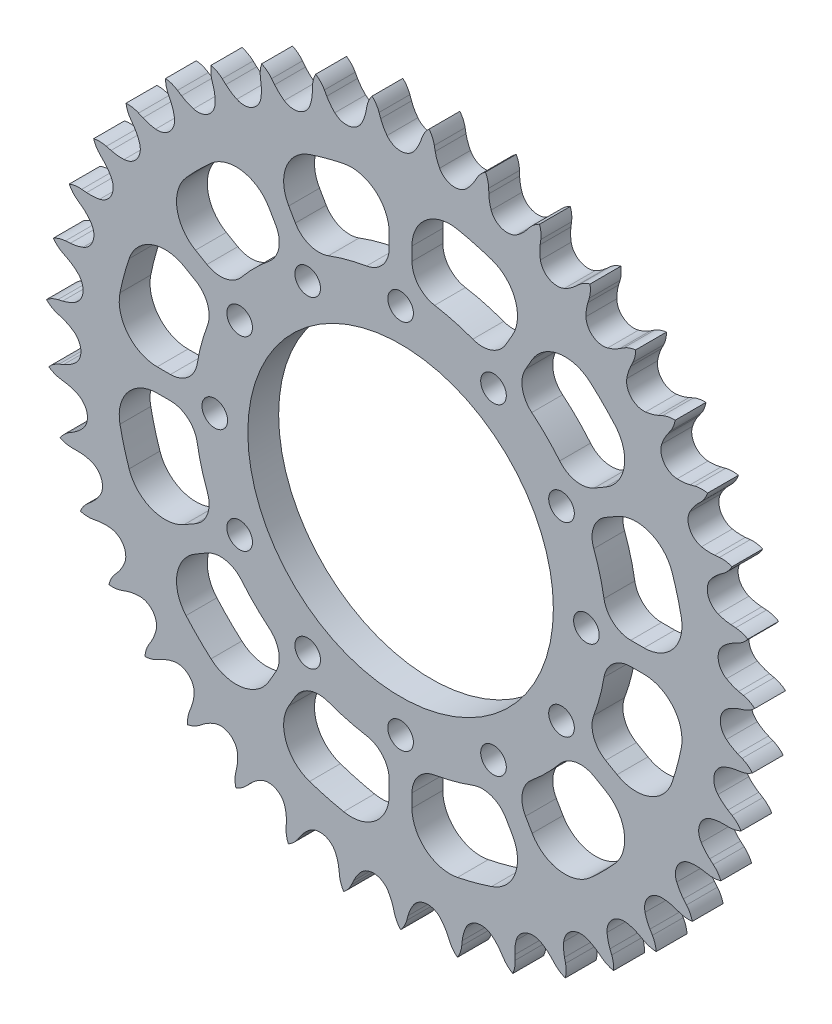
from build123d import *

# Parameters (mm, degrees)
EXTRUSION_DEPTH        = 7.2136
CUT_EXTRUDE_DEPTH      = 118.514389318
CUT_EXTRUDE_DEPTH_BACK = 118.514389318
SKETCH1_R              = 35.764294032
F_6_0MM_DOWEL_HOLE1_D  = 6
CIRPATTERN1_COUNT      = 12
CUT_OUT1_DEPTH         = 118.514389318
FILLET2_R              = 6.35
FILLET3_R              = 8.89


with BuildPart() as part:
    # Teeth Sketch → Extrusion (new body)
    with BuildSketch(Plane.XY):
        with BuildLine():
            ThreePointArc((6.676484762, 82.703103732), (5.710873677, 81.555589606), (5.037571935, 80.215493266))
            Line((5.037571935, 80.215493266), (4.65053543, 79.150636707))
            ThreePointArc((4.65053543, 79.150636707), (4.012412733, 77.75443626), (3.175286755, 76.467658749))
            ThreePointArc((3.175286755, 76.467658749), (0, 74.905926143), (-3.175286755, 76.467658749))
            ThreePointArc((-3.175286755, 76.467658749), (-4.012412733, 77.75443626), (-4.65053543, 79.150636707))
            Line((-4.65053543, 79.150636707), (-5.037571935, 80.215493266))
            ThreePointArc((-5.037571935, 80.215493266), (-5.710873677, 81.555589606), (-6.676484762, 82.703103732))
            ThreePointArc((-6.676484762, 82.703103732), (-7.445517227, 81.415554702), (-7.895133318, 79.984807062))
            Line((-7.895133318, 79.984807062), (-8.106342797, 78.871655094))
            ThreePointArc((-8.106342797, 78.871655094), (-8.512235671, 77.391172997), (-9.132107458, 75.986774467))
            ThreePointArc((-9.132107458, 75.986774467), (-12.015755556, 73.935914073), (-15.40044271, 74.968070836))
            ThreePointArc((-15.40044271, 74.968070836), (-16.433141755, 76.103900466), (-17.286967233, 77.379658404))
            Line((-17.286967233, 77.379658404), (-17.83980672, 78.368640329))
            ThreePointArc((-17.83980672, 78.368640329), (-18.719355953, 79.583377579), (-19.856536839, 80.561136787))
            ThreePointArc((-19.856536839, 80.561136787), (-20.409073146, 79.166899696), (-20.623358765, 77.682556369))
            Line((-20.623358765, 77.682556369), (-20.653271004, 76.549939044))
            ThreePointArc((-20.653271004, 76.549939044), (-20.816421642, 75.023519006), (-21.202984886, 73.53787264))
            ThreePointArc((-21.202984886, 73.53787264), (-23.720309356, 71.051000665), (-27.226735288, 71.526849267))
            ThreePointArc((-27.226735288, 71.526849267), (-28.428261037, 72.482313625), (-29.475675664, 73.604587595))
            Line((-29.475675664, 73.604587595), (-30.179999883, 74.492080773))
            ThreePointArc((-30.179999883, 74.492080773), (-31.243016742, 75.549997876), (-32.522315041, 76.332678717))
            ThreePointArc((-32.522315041, 76.332678717), (-32.844044791, 74.867863573), (-32.817450053, 73.368368272))
            Line((-32.817450053, 73.368368272), (-32.66529034, 72.245619783))
            ThreePointArc((-32.66529034, 72.245619783), (-32.581473228, 70.71279528), (-32.724716142, 69.18437854))
            ThreePointArc((-32.724716142, 69.18437854), (-34.810519602, 66.325903661), (-38.347869723, 66.233119874))
            ThreePointArc((-38.347869723, 66.233119874), (-39.687103291, 66.983472935), (-40.900979579, 67.923196629))
            Line((-40.900979579, 67.923196629), (-41.738546902, 68.686215454))
            ThreePointArc((-41.738546902, 68.686215454), (-42.957499809, 69.559912912), (-44.345782367, 70.127244363))
            ThreePointArc((-44.345782367, 70.127244363), (-44.428372928, 68.629789109), (-44.161586623, 67.153977974))
            Line((-44.161586623, 67.153977974), (-43.831295815, 66.070176918))
            ThreePointArc((-43.831295815, 66.070176918), (-43.50268177, 64.570647301), (-43.39889444, 63.039045376))
            ThreePointArc((-43.39889444, 63.039045376), (-44.999155676, 59.883000591), (-48.475814476, 59.223987466))
            ThreePointArc((-48.475814476, 59.223987466), (-49.918070416, 59.74979548), (-51.266969607, 60.48263055))
            Line((-51.266969607, 60.48263055), (-52.21608748, 61.101413234))
            ThreePointArc((-52.21608748, 61.101413234), (-53.559406195, 61.768262742), (-55.020717224, 62.105551216))
            ThreePointArc((-55.020717224, 62.105551216), (-54.862029543, 60.614239157), (-54.361961296, 59.200334922))
            Line((-54.361961296, 59.200334922), (-53.862093752, 58.183551176))
            ThreePointArc((-53.862093752, 58.183551176), (-53.297193706, 56.756153473), (-52.949064168, 55.26103405))
            ThreePointArc((-52.949064168, 55.26103405), (-54.022337255, 51.889159262), (-57.348261097, 50.680984892))
            ThreePointArc((-57.348261097, 50.680984892), (-58.856185739, 50.968629708), (-60.305172051, 51.475596109))
            Line((-60.305172051, 51.475596109), (-61.34125882, 51.934116506))
            ThreePointArc((-61.34125882, 51.934116506), (-62.774152094, 52.376847013), (-64.270644405, 52.475356916))
            ThreePointArc((-64.270644405, 52.475356916), (-63.87478841, 51.02881225), (-63.154389727, 49.713434291))
            Line((-63.154389727, 49.713434291), (-62.497891753, 48.790002021))
            ThreePointArc((-62.497891753, 48.790002021), (-61.711336321, 47.471705084), (-61.127880947, 46.05179097))
            ThreePointArc((-61.127880947, 46.05179097), (-61.646368676, 42.551415963), (-64.73541788, 40.825371431))
            ThreePointArc((-64.73541788, 40.825371431), (-66.269956766, 40.867403199), (-67.781502216, 41.135370767))
            Line((-67.781502216, 41.135370767), (-68.877723777, 41.42175344))
            ThreePointArc((-68.877723777, 41.42175344), (-70.363080428, 41.628898458), (-71.855995657, 41.486078435))
            ThreePointArc((-71.855995657, 41.486078435), (-71.23322381, 40.12176591), (-70.311152637, 38.938981826))
            Line((-70.311152637, 38.938981826), (-69.515027187, 38.132817442))
            ThreePointArc((-69.515027187, 38.132817442), (-68.52718774, 36.957764468), (-67.723517718, 35.649830693))
            ThreePointArc((-67.723517718, 35.649830693), (-67.673791529, 32.111613343), (-70.445961343, 29.912402295))
            ThreePointArc((-70.445961343, 29.912402295), (-71.967370724, 29.707732413), (-73.502327078, 29.729760931))
            Line((-73.502327078, 29.729760931), (-74.630291869, 29.836588719))
            ThreePointArc((-74.630291869, 29.836588719), (-76.129641939, 29.8027833), (-77.580314364, 29.422332315))
            ThreePointArc((-77.580314364, 29.422332315), (-76.74675613, 28.175586908), (-75.646893627, 27.156030185))
            Line((-75.646893627, 27.156030185), (-74.731759931, 26.488012922))
            ThreePointArc((-74.731759931, 26.488012922), (-73.568220993, 25.486637166), (-72.565150954, 24.324558527))
            ThreePointArc((-72.565150954, 24.324558527), (-71.948498729, 20.840136804), (-74.331991411, 18.224717651))
            ThreePointArc((-74.331991411, 18.224717651), (-75.800867582, 17.778646963), (-77.319480277, 17.554165902))
            Line((-77.319480277, 17.554165902), (-78.449974603, 17.478672021))
            ThreePointArc((-78.449974603, 17.478672021), (-79.924485713, 17.204791709), (-81.295343681, 16.596563242))
            ThreePointArc((-81.295343681, 16.596563242), (-80.27258778, 15.499675005), (-79.023419807, 14.669751627))
            Line((-79.023419807, 14.669751627), (-78.012979347, 14.15718278))
            ThreePointArc((-78.012979347, 14.15718278), (-76.703875965, 13.355419348), (-75.527384897, 12.369293072))
            ThreePointArc((-75.527384897, 12.369293072), (-74.359777605, 9.028911669), (-76.292861946, 6.065022393))
            ThreePointArc((-76.292861946, 6.065022393), (-77.671161786, 5.389103895), (-79.134099551, 4.923927198))
            Line((-79.134099551, 4.923927198), (-80.237844202, 4.6680669))
            ThreePointArc((-80.237844202, 4.6680669), (-81.649327289, 4.161205049), (-82.904866299, 3.340951899))
            ThreePointArc((-82.904866299, 3.340951899), (-81.719401571, 2.422329661), (-80.353280924, 1.803534207))
            Line((-80.353280924, 1.803534207), (-79.273703577, 1.45968904))
            ThreePointArc((-79.273703577, 1.45968904), (-77.852940841, 0.878303185), (-76.533499244, 0.093669424))
            ThreePointArc((-76.533499244, 0.093669424), (-74.8451773, -3.016157536), (-76.277787432, -6.251753759))
            ThreePointArc((-76.277787432, -6.251753759), (-77.529813699, -7.140014132), (-78.899187214, -7.833838635))
            Line((-78.899187214, -7.833838635), (-79.947595784, -8.263438702))
            ThreePointArc((-79.947595784, -8.263438702), (-81.259494176, -8.990154635), (-82.367196428, -10.001188343))
            ThreePointArc((-82.367196428, -10.001188343), (-81.049725787, -10.717752749), (-79.602034272, -11.109393802))
            Line((-79.602034272, -11.109393802), (-78.481280524, -11.275609878))
            ThreePointArc((-78.481280524, -11.275609878), (-76.985655443, -11.621560569), (-75.557436162, -12.184380212))
            ThreePointArc((-75.557436162, -12.184380212), (-73.392126218, -14.983109845), (-74.28715829, -18.406612773))
            ThreePointArc((-74.28715829, -18.406612773), (-75.380484162, -19.484209545), (-76.620827372, -20.388712162))
            Line((-76.620827372, -20.388712162), (-77.586746629, -20.980925582))
            ThreePointArc((-77.586746629, -20.980925582), (-78.765082849, -21.908674036), (-79.696259435, -23.08430306))
            ThreePointArc((-79.696259435, -23.08430306), (-78.280904679, -23.580250992), (-76.789136745, -23.734594346))
            Line((-76.789136745, -23.734594346), (-75.656233531, -23.718876424))
            ThreePointArc((-75.656233531, -23.718876424), (-74.124482008, -23.820432009), (-72.624475172, -24.146860802))
            ThreePointArc((-72.624475172, -24.146860802), (-70.038257617, -26.562007479), (-70.372530769, -30.084750184))
            ThreePointArc((-70.372530769, -30.084750184), (-71.27883968, -31.323774165), (-72.358028349, -32.415528753))
            Line((-72.358028349, -32.415528753), (-73.216441492, -33.155017511))
            ThreePointArc((-73.216441492, -33.155017511), (-74.230697248, -34.259770288), (-74.961231185, -35.569546454))
            ThreePointArc((-74.961231185, -35.569546454), (-73.484649258, -35.832033121), (-71.987440912, -35.745081364))
            Line((-71.987440912, -35.745081364), (-70.871729829, -35.547836529))
            ThreePointArc((-70.871729829, -35.547836529), (-69.343523424, -35.402366773), (-67.810578422, -35.48395038))
            ThreePointArc((-67.810578422, -35.48395038), (-64.870434934, -37.452963072), (-64.635291667, -40.983708369))
            ThreePointArc((-64.635291667, -40.983708369), (-65.331110692, -42.352069487), (-66.221194398, -43.602800177))
            Line((-66.221194398, -43.602800177), (-66.949868978, -44.470411902))
            ThreePointArc((-66.949868978, -44.470411902), (-67.773775581, -45.723556485), (-68.284746423, -47.133557278))
            ThreePointArc((-68.284746423, -47.133557278), (-66.785180021, -47.155784414), (-65.321308173, -46.829789551))
            Line((-65.321308173, -46.829789551), (-64.251685552, -46.456126341))
            ThreePointArc((-64.251685552, -46.456126341), (-62.766604009, -46.067398833), (-61.240423311, -45.902024283))
            ThreePointArc((-61.240423311, -45.902024283), (-58.022502061, -47.373906594), (-57.224032462, -50.821210034))
            ThreePointArc((-57.224032462, -50.821210034), (-57.691340253, -52.283468456), (-58.369266298, -53.66078198))
            Line((-58.369266298, -53.66078198), (-58.949330025, -54.634045983))
            ThreePointArc((-58.949330025, -54.634045983), (-59.561548726, -56.003126587), (-59.839722596, -57.476833727))
            ThreePointArc((-59.839722596, -57.476833727), (-58.356009703, -57.25822566), (-56.963387864, -56.701630787))
            Line((-56.963387864, -56.701630787), (-55.967556369, -56.161226883))
            ThreePointArc((-55.967556369, -56.161226883), (-54.564062519, -55.539309461), (-53.084173404, -55.131259867))
            ThreePointArc((-53.084173404, -55.131259867), (-49.671816862, -56.06789082), (-48.330700874, -59.342469055))
            ThreePointArc((-48.330700874, -59.342469055), (-48.557394406, -60.860753056), (-49.00560486, -62.328977716))
            Line((-49.00560486, -62.328977716), (-49.422034389, -63.382686971))
            ThreePointArc((-49.422034389, -63.382686971), (-49.806709045, -64.832245127), (-49.844881387, -66.331490374))
            ThreePointArc((-49.844881387, -66.331490374), (-48.415449386, -65.877708938), (-47.130145731, -65.104929569))
            Line((-47.130145731, -65.104929569), (-46.233896874, -64.411781148))
            ThreePointArc((-46.233896874, -64.411781148), (-44.948340472, -63.572781148), (-43.55307129, -62.932624781))
            ThreePointArc((-43.55307129, -62.932624781), (-40.034657698, -63.309746125), (-38.185629521, -66.326789298))
            ThreePointArc((-38.185629521, -66.326789298), (-38.16583755, -67.86177612), (-38.372723998, -69.38288567))
            Line((-38.372723998, -69.38288567), (-38.614734022, -70.489749661))
            ThreePointArc((-38.614734022, -70.489749661), (-38.761901763, -71.982242573), (-38.559083932, -73.468196262))
            ThreePointArc((-38.559083932, -73.468196262), (-37.220954361, -72.790994159), (-36.076257579, -71.822044874))
            Line((-36.076257579, -71.822044874), (-35.302803736, -70.994104116))
            ThreePointArc((-35.302803736, -70.994104116), (-34.168480016, -69.959751196), (-32.893967506, -69.104067769))
            ThreePointArc((-32.893967506, -69.104067769), (-29.360621929, -68.91191226), (-27.051570421, -71.593280539))
            ThreePointArc((-27.051570421, -71.593280539), (-26.785805549, -73.105214829), (-26.74600974, -74.639813329))
            Line((-26.74600974, -74.639813329), (-26.807332328, -75.77116486))
            ThreePointArc((-26.807332328, -75.77116486), (-26.713181585, -77.267937748), (-26.274626458, -78.702114459))
            ThreePointArc((-26.274626458, -78.702114459), (-25.06245617, -77.819030866), (-24.088013307, -76.679006943))
            Line((-24.088013307, -76.679006943), (-23.457386525, -75.737717079))
            ThreePointArc((-23.457386525, -75.737717079), (-22.503673876, -74.534800437), (-21.382927243, -73.485751701))
            ThreePointArc((-21.382927243, -73.485751701), (-17.926161474, -72.729296065), (-15.216889857, -75.005543419))
            ThreePointArc((-15.216889857, -75.005543419), (-14.712035254, -76.455266874), (-14.426587879, -77.96360903))
            Line((-14.426587879, -77.96360903), (-14.305634807, -79.090146691))
            ThreePointArc((-14.305634807, -79.090146691), (-13.972604036, -80.552433921), (-13.309669959, -81.897689231))
            ThreePointArc((-13.309669959, -81.897689231), (-12.254853529, -80.83159555), (-11.475902142, -79.55002301))
            Line((-11.475902142, -79.55002301), (-11.004435324, -78.519762952))
            ThreePointArc((-11.004435324, -78.519762952), (-10.256034403, -77.179437497), (-9.318080396, -75.964193264))
            ThreePointArc((-9.318080396, -75.964193264), (-6.027422853, -74.663029306), (-2.988099839, -76.475202124))
            ThreePointArc((-2.988099839, -76.475202124), (-2.257230974, -77.825167667), (-1.733524971, -79.26818821))
            Line((-1.733524971, -79.26818821), (-1.43342886, -80.360735266))
            ThreePointArc((-1.43342886, -80.360735266), (-0.870143382, -81.750664368), (0, -82.97215687))
            ThreePointArc((0, -82.97215687), (0.870143382, -81.750664368), (1.43342886, -80.360735266))
            Line((1.43342886, -80.360735266), (1.733524971, -79.26818821))
            ThreePointArc((1.733524971, -79.26818821), (2.257230974, -77.825167667), (2.988099839, -76.475202124))
            ThreePointArc((2.988099839, -76.475202124), (6.027422853, -74.663029306), (9.318080396, -75.964193264))
            ThreePointArc((9.318080396, -75.964193264), (10.256034403, -77.179437497), (11.004435324, -78.519762952))
            Line((11.004435324, -78.519762952), (11.475902142, -79.55002301))
            ThreePointArc((11.475902142, -79.55002301), (12.254853529, -80.83159555), (13.309669959, -81.897689231))
            ThreePointArc((13.309669959, -81.897689231), (13.972604036, -80.552433921), (14.305634807, -79.090146691))
            Line((14.305634807, -79.090146691), (14.426587879, -77.96360903))
            ThreePointArc((14.426587879, -77.96360903), (14.712035254, -76.455266874), (15.216889857, -75.005543419))
            ThreePointArc((15.216889857, -75.005543419), (17.926161474, -72.729296065), (21.382927243, -73.485751701))
            ThreePointArc((21.382927243, -73.485751701), (22.503673876, -74.534800437), (23.457386525, -75.737717079))
            Line((23.457386525, -75.737717079), (24.088013307, -76.679006943))
            ThreePointArc((24.088013307, -76.679006943), (25.06245617, -77.819030866), (26.274626458, -78.702114459))
            ThreePointArc((26.274626458, -78.702114459), (26.713181585, -77.267937748), (26.807332328, -75.77116486))
            Line((26.807332328, -75.77116486), (26.74600974, -74.639813329))
            ThreePointArc((26.74600974, -74.639813329), (26.785805549, -73.105214829), (27.051570421, -71.593280539))
            ThreePointArc((27.051570421, -71.593280539), (29.360621929, -68.91191226), (32.893967506, -69.104067769))
            ThreePointArc((32.893967506, -69.104067769), (34.168480016, -69.959751196), (35.302803736, -70.994104116))
            Line((35.302803736, -70.994104116), (36.076257579, -71.822044874))
            ThreePointArc((36.076257579, -71.822044874), (37.220954361, -72.790994159), (38.559083932, -73.468196262))
            ThreePointArc((38.559083932, -73.468196262), (38.761901763, -71.982242573), (38.614734022, -70.489749661))
            Line((38.614734022, -70.489749661), (38.372723998, -69.38288567))
            ThreePointArc((38.372723998, -69.38288567), (38.16583755, -67.86177612), (38.185629521, -66.326789298))
            ThreePointArc((38.185629521, -66.326789298), (40.034657698, -63.309746125), (43.55307129, -62.932624781))
            ThreePointArc((43.55307129, -62.932624781), (44.948340472, -63.572781148), (46.233896874, -64.411781148))
            Line((46.233896874, -64.411781148), (47.130145731, -65.104929569))
            ThreePointArc((47.130145731, -65.104929569), (48.415449386, -65.877708938), (49.844881387, -66.331490374))
            ThreePointArc((49.844881387, -66.331490374), (49.806709045, -64.832245127), (49.422034389, -63.382686971))
            Line((49.422034389, -63.382686971), (49.00560486, -62.328977716))
            ThreePointArc((49.00560486, -62.328977716), (48.557394406, -60.860753056), (48.330700874, -59.342469055))
            ThreePointArc((48.330700874, -59.342469055), (49.671816862, -56.06789082), (53.084173404, -55.131259867))
            ThreePointArc((53.084173404, -55.131259867), (54.564062519, -55.539309461), (55.967556369, -56.161226883))
            Line((55.967556369, -56.161226883), (56.963387864, -56.701630787))
            ThreePointArc((56.963387864, -56.701630787), (58.356009703, -57.25822566), (59.839722596, -57.476833727))
            ThreePointArc((59.839722596, -57.476833727), (59.561548726, -56.003126587), (58.949330025, -54.634045983))
            Line((58.949330025, -54.634045983), (58.369266298, -53.66078198))
            ThreePointArc((58.369266298, -53.66078198), (57.691340253, -52.283468456), (57.224032462, -50.821210034))
            ThreePointArc((57.224032462, -50.821210034), (58.022502061, -47.373906594), (61.240423311, -45.902024283))
            ThreePointArc((61.240423311, -45.902024283), (62.766604009, -46.067398833), (64.251685552, -46.456126341))
            Line((64.251685552, -46.456126341), (65.321308173, -46.829789551))
            ThreePointArc((65.321308173, -46.829789551), (66.785180021, -47.155784414), (68.284746423, -47.133557278))
            ThreePointArc((68.284746423, -47.133557278), (67.773775581, -45.723556485), (66.949868978, -44.470411902))
            Line((66.949868978, -44.470411902), (66.221194398, -43.602800177))
            ThreePointArc((66.221194398, -43.602800177), (65.331110692, -42.352069487), (64.635291667, -40.983708369))
            ThreePointArc((64.635291667, -40.983708369), (64.870434934, -37.452963072), (67.810578422, -35.48395038))
            ThreePointArc((67.810578422, -35.48395038), (69.343523424, -35.402366773), (70.871729829, -35.547836529))
            Line((70.871729829, -35.547836529), (71.987440912, -35.745081364))
            ThreePointArc((71.987440912, -35.745081364), (73.484649258, -35.832033121), (74.961231185, -35.569546454))
            ThreePointArc((74.961231185, -35.569546454), (74.230697248, -34.259770288), (73.216441492, -33.155017511))
            Line((73.216441492, -33.155017511), (72.358028349, -32.415528753))
            ThreePointArc((72.358028349, -32.415528753), (71.27883968, -31.323774165), (70.372530769, -30.084750184))
            ThreePointArc((70.372530769, -30.084750184), (70.038257617, -26.562007479), (72.624475172, -24.146860802))
            ThreePointArc((72.624475172, -24.146860802), (74.124482008, -23.820432009), (75.656233531, -23.718876424))
            Line((75.656233531, -23.718876424), (76.789136745, -23.734594346))
            ThreePointArc((76.789136745, -23.734594346), (78.280904679, -23.580250992), (79.696259435, -23.08430306))
            ThreePointArc((79.696259435, -23.08430306), (78.765082849, -21.908674036), (77.586746629, -20.980925582))
            Line((77.586746629, -20.980925582), (76.620827372, -20.388712162))
            ThreePointArc((76.620827372, -20.388712162), (75.380484162, -19.484209545), (74.28715829, -18.406612773))
            ThreePointArc((74.28715829, -18.406612773), (73.392126218, -14.983109845), (75.557436162, -12.184380212))
            ThreePointArc((75.557436162, -12.184380212), (76.985655443, -11.621560569), (78.481280524, -11.275609878))
            Line((78.481280524, -11.275609878), (79.602034272, -11.109393802))
            ThreePointArc((79.602034272, -11.109393802), (81.049725787, -10.717752749), (82.367196428, -10.001188343))
            ThreePointArc((82.367196428, -10.001188343), (81.259494176, -8.990154635), (79.947595784, -8.263438702))
            Line((79.947595784, -8.263438702), (78.899187214, -7.833838635))
            ThreePointArc((78.899187214, -7.833838635), (77.529813699, -7.140014132), (76.277787432, -6.251753759))
            ThreePointArc((76.277787432, -6.251753759), (74.8451773, -3.016157536), (76.533499244, 0.093669424))
            ThreePointArc((76.533499244, 0.093669424), (77.852940841, 0.878303185), (79.273703577, 1.45968904))
            Line((79.273703577, 1.45968904), (80.353280924, 1.803534207))
            ThreePointArc((80.353280924, 1.803534207), (81.719401571, 2.422329661), (82.904866299, 3.340951899))
            ThreePointArc((82.904866299, 3.340951899), (81.649327289, 4.161205049), (80.237844202, 4.6680669))
            Line((80.237844202, 4.6680669), (79.134099551, 4.923927198))
            ThreePointArc((79.134099551, 4.923927198), (77.671161786, 5.389103895), (76.292861946, 6.065022393))
            ThreePointArc((76.292861946, 6.065022393), (74.359777605, 9.028911669), (75.527384897, 12.369293072))
            ThreePointArc((75.527384897, 12.369293072), (76.703875965, 13.355419348), (78.012979347, 14.15718278))
            Line((78.012979347, 14.15718278), (79.023419807, 14.669751627))
            ThreePointArc((79.023419807, 14.669751627), (80.27258778, 15.499675005), (81.295343681, 16.596563242))
            ThreePointArc((81.295343681, 16.596563242), (79.924485713, 17.204791709), (78.449974603, 17.478672021))
            Line((78.449974603, 17.478672021), (77.319480277, 17.554165902))
            ThreePointArc((77.319480277, 17.554165902), (75.800867582, 17.778646963), (74.331991411, 18.224717651))
            ThreePointArc((74.331991411, 18.224717651), (71.948498729, 20.840136804), (72.565150954, 24.324558527))
            ThreePointArc((72.565150954, 24.324558527), (73.568220993, 25.486637166), (74.731759931, 26.488012922))
            Line((74.731759931, 26.488012922), (75.646893627, 27.156030185))
            ThreePointArc((75.646893627, 27.156030185), (76.74675613, 28.175586908), (77.580314364, 29.422332315))
            ThreePointArc((77.580314364, 29.422332315), (76.129641939, 29.8027833), (74.630291869, 29.836588719))
            Line((74.630291869, 29.836588719), (73.502327078, 29.729760931))
            ThreePointArc((73.502327078, 29.729760931), (71.967370724, 29.707732413), (70.445961343, 29.912402295))
            ThreePointArc((70.445961343, 29.912402295), (67.673791529, 32.111613343), (67.723517718, 35.649830693))
            ThreePointArc((67.723517718, 35.649830693), (68.52718774, 36.957764468), (69.515027187, 38.132817442))
            Line((69.515027187, 38.132817442), (70.311152637, 38.938981826))
            ThreePointArc((70.311152637, 38.938981826), (71.23322381, 40.12176591), (71.855995657, 41.486078435))
            ThreePointArc((71.855995657, 41.486078435), (70.363080428, 41.628898458), (68.877723777, 41.42175344))
            Line((68.877723777, 41.42175344), (67.781502216, 41.135370767))
            ThreePointArc((67.781502216, 41.135370767), (66.269956766, 40.867403199), (64.73541788, 40.825371431))
            ThreePointArc((64.73541788, 40.825371431), (61.646368676, 42.551415963), (61.127880947, 46.05179097))
            ThreePointArc((61.127880947, 46.05179097), (61.711336321, 47.471705084), (62.497891753, 48.790002021))
            Line((62.497891753, 48.790002021), (63.154389727, 49.713434291))
            ThreePointArc((63.154389727, 49.713434291), (63.87478841, 51.02881225), (64.270644405, 52.475356916))
            ThreePointArc((64.270644405, 52.475356916), (62.774152094, 52.376847013), (61.34125882, 51.934116506))
            Line((61.34125882, 51.934116506), (60.305172051, 51.475596109))
            ThreePointArc((60.305172051, 51.475596109), (58.856185739, 50.968629708), (57.348261097, 50.680984892))
            ThreePointArc((57.348261097, 50.680984892), (54.022337255, 51.889159262), (52.949064168, 55.26103405))
            ThreePointArc((52.949064168, 55.26103405), (53.297193706, 56.756153473), (53.862093752, 58.183551176))
            Line((53.862093752, 58.183551176), (54.361961296, 59.200334922))
            ThreePointArc((54.361961296, 59.200334922), (54.862029543, 60.614239157), (55.020717224, 62.105551216))
            ThreePointArc((55.020717224, 62.105551216), (53.559406195, 61.768262742), (52.21608748, 61.101413234))
            Line((52.21608748, 61.101413234), (51.266969607, 60.48263055))
            ThreePointArc((51.266969607, 60.48263055), (49.918070416, 59.74979548), (48.475814476, 59.223987466))
            ThreePointArc((48.475814476, 59.223987466), (44.999155676, 59.883000591), (43.39889444, 63.039045376))
            ThreePointArc((43.39889444, 63.039045376), (43.50268177, 64.570647301), (43.831295815, 66.070176918))
            Line((43.831295815, 66.070176918), (44.161586623, 67.153977974))
            ThreePointArc((44.161586623, 67.153977974), (44.428372928, 68.629789109), (44.345782367, 70.127244363))
            ThreePointArc((44.345782367, 70.127244363), (42.957499809, 69.559912912), (41.738546902, 68.686215454))
            Line((41.738546902, 68.686215454), (40.900979579, 67.923196629))
            ThreePointArc((40.900979579, 67.923196629), (39.687103291, 66.983472935), (38.347869723, 66.233119874))
            ThreePointArc((38.347869723, 66.233119874), (34.810519602, 66.325903661), (32.724716142, 69.18437854))
            ThreePointArc((32.724716142, 69.18437854), (32.581473228, 70.71279528), (32.66529034, 72.245619783))
            Line((32.66529034, 72.245619783), (32.817450053, 73.368368272))
            ThreePointArc((32.817450053, 73.368368272), (32.844044791, 74.867863573), (32.522315041, 76.332678717))
            ThreePointArc((32.522315041, 76.332678717), (31.243016742, 75.549997876), (30.179999883, 74.492080773))
            Line((30.179999883, 74.492080773), (29.475675664, 73.604587595))
            ThreePointArc((29.475675664, 73.604587595), (28.428261037, 72.482313625), (27.226735288, 71.526849267))
            ThreePointArc((27.226735288, 71.526849267), (23.720309356, 71.051000665), (21.202984886, 73.53787264))
            ThreePointArc((21.202984886, 73.53787264), (20.816421642, 75.023519006), (20.653271004, 76.549939044))
            Line((20.653271004, 76.549939044), (20.623358765, 77.682556369))
            ThreePointArc((20.623358765, 77.682556369), (20.409073146, 79.166899696), (19.856536839, 80.561136787))
            ThreePointArc((19.856536839, 80.561136787), (18.719355953, 79.583377579), (17.83980672, 78.368640329))
            Line((17.83980672, 78.368640329), (17.286967233, 77.379658404))
            ThreePointArc((17.286967233, 77.379658404), (16.433141755, 76.103900466), (15.40044271, 74.968070836))
            ThreePointArc((15.40044271, 74.968070836), (12.015755556, 73.935914073), (9.132107458, 75.986774467))
            ThreePointArc((9.132107458, 75.986774467), (8.512235671, 77.391172997), (8.106342797, 78.871655094))
            Line((8.106342797, 78.871655094), (7.895133318, 79.984807062))
            ThreePointArc((7.895133318, 79.984807062), (7.445517227, 81.415554702), (6.676484762, 82.703103732))
        make_face()
    extrude(amount=EXTRUSION_DEPTH)

    # Sketch1 → Cut-Extrude (cut, two sides: drawn at the far end of the back side and taken through both)
    with BuildSketch(Plane(origin=(0, 0, 0), x_dir=(-1, 0, 0), z_dir=(0, 0, -1)).offset(-CUT_EXTRUDE_DEPTH_BACK)):
        Circle(SKETCH1_R)
    extrude(amount=CUT_EXTRUDE_DEPTH + CUT_EXTRUDE_DEPTH_BACK, mode=Mode.SUBTRACT)

    # Ø6.0mm Dowel Hole1 (through all)
    with Locations(Plane.XY.offset(7.2136)):
        with Locations((-43.500000122, 0)):
            f_6_0mm_dowel_hole1 = Hole(F_6_0MM_DOWEL_HOLE1_D / 2)

    # CirPattern1: Ø6.0mm Dowel Hole1 ×12 about axis
    cirpattern1_axis = Axis((0, 0, 7.2136), (0, 0, -1))
    for i in range(1, CIRPATTERN1_COUNT):
        add(f_6_0mm_dowel_hole1.rotate(cirpattern1_axis, i * 360 / CIRPATTERN1_COUNT), mode=Mode.SUBTRACT)

    # Sketch9 → Cut-Out1 (cut, through all)
    with BuildSketch(Plane.XY.offset(7.2136)):
        with BuildLine():
            Line((2.667, 66.97884915), (2.667, 48.204277889))
            ThreePointArc((2.667, 48.204277889), (12.495265891, 46.632967159), (21.792449193, 43.079629223))
            Line((21.792449193, 43.079629223), (31.179734823, 59.33888488))
            ThreePointArc((31.179734823, 59.33888488), (17.349139116, 64.747868648), (2.667, 66.97884915))
        make_face()
        with BuildLine():
            ThreePointArc((-21.792449193, 43.079629223), (-12.495265891, 46.632967159), (-2.667, 48.204277889))
            Line((-2.667, 48.204277889), (-2.667, 66.97884915))
            ThreePointArc((-2.667, 66.97884915), (-17.349139116, 64.747868648), (-31.179734823, 59.33888488))
            Line((-31.179734823, 59.33888488), (-21.792449193, 43.079629223))
        make_face()
        with BuildLine():
            Line((35.799114327, 56.67188488), (26.411828696, 40.412629223))
            ThreePointArc((26.411828696, 40.412629223), (34.137701268, 34.137701268), (40.412629223, 26.411828696))
            Line((40.412629223, 26.411828696), (56.67188488, 35.799114327))
            ThreePointArc((56.67188488, 35.799114327), (47.398729532, 47.398729532), (35.799114327, 56.67188488))
        make_face()
        with BuildLine():
            ThreePointArc((-40.412629223, 26.411828696), (-34.137701268, 34.137701268), (-26.411828696, 40.412629223))
            Line((-26.411828696, 40.412629223), (-35.799114327, 56.67188488))
            ThreePointArc((-35.799114327, 56.67188488), (-47.398729532, 47.398729532), (-56.67188488, 35.799114327))
            Line((-56.67188488, 35.799114327), (-40.412629223, 26.411828696))
        make_face()
        with BuildLine():
            Line((59.33888488, 31.179734823), (43.079629223, 21.792449193))
            ThreePointArc((43.079629223, 21.792449193), (46.632967159, 12.495265891), (48.204277889, 2.667))
            Line((48.204277889, 2.667), (66.97884915, 2.667))
            ThreePointArc((66.97884915, 2.667), (64.747868648, 17.349139116), (59.33888488, 31.179734823))
        make_face()
        with BuildLine():
            ThreePointArc((-48.204277889, 2.667), (-46.632967159, 12.495265891), (-43.079629223, 21.792449193))
            Line((-43.079629223, 21.792449192), (-59.33888488, 31.179734823))
            ThreePointArc((-59.33888488, 31.179734823), (-64.747868648, 17.349139116), (-66.97884915, 2.667))
            Line((-66.97884915, 2.667), (-48.204277889, 2.667))
        make_face()
        with BuildLine():
            ThreePointArc((-43.079629223, -21.792449193), (-46.632967159, -12.495265891), (-48.204277889, -2.667))
            Line((-48.204277889, -2.667), (-66.97884915, -2.667))
            ThreePointArc((-66.97884915, -2.667), (-64.747868648, -17.349139116), (-59.33888488, -31.179734823))
            Line((-59.33888488, -31.179734823), (-43.079629223, -21.792449193))
        make_face()
        with BuildLine():
            Line((66.97884915, -2.667), (48.204277889, -2.667))
            ThreePointArc((48.204277889, -2.667), (46.632967159, -12.495265891), (43.079629223, -21.792449192))
            Line((43.079629223, -21.792449192), (59.33888488, -31.179734823))
            ThreePointArc((59.33888488, -31.179734823), (64.747868648, -17.349139116), (66.97884915, -2.667))
        make_face()
        with BuildLine():
            ThreePointArc((-26.411828696, -40.412629223), (-34.137701268, -34.137701268), (-40.412629223, -26.411828696))
            Line((-40.412629223, -26.411828696), (-56.67188488, -35.799114327))
            ThreePointArc((-56.67188488, -35.799114327), (-47.398729532, -47.398729532), (-35.799114327, -56.67188488))
            Line((-35.799114327, -56.67188488), (-26.411828696, -40.412629223))
        make_face()
        with BuildLine():
            Line((56.67188488, -35.799114327), (40.412629223, -26.411828696))
            ThreePointArc((40.412629223, -26.411828696), (34.137701268, -34.137701268), (26.411828696, -40.412629223))
            Line((26.411828696, -40.412629223), (35.799114327, -56.67188488))
            ThreePointArc((35.799114327, -56.67188488), (47.398729532, -47.398729532), (56.67188488, -35.799114327))
        make_face()
        with BuildLine():
            ThreePointArc((-2.667, -48.204277889), (-12.495265891, -46.632967159), (-21.792449192, -43.079629223))
            Line((-21.792449192, -43.079629223), (-31.179734823, -59.33888488))
            ThreePointArc((-31.179734823, -59.33888488), (-17.349139116, -64.747868648), (-2.667, -66.97884915))
            Line((-2.667, -66.97884915), (-2.667, -48.204277889))
        make_face()
        with BuildLine():
            Line((31.179734823, -59.33888488), (21.792449193, -43.079629223))
            ThreePointArc((21.792449193, -43.079629223), (12.495265891, -46.632967159), (2.667, -48.204277889))
            Line((2.667, -48.204277889), (2.667, -66.97884915))
            ThreePointArc((2.667, -66.97884915), (17.349139116, -64.747868648), (31.179734823, -59.33888488))
        make_face()
    extrude(amount=-CUT_OUT1_DEPTH, mode=Mode.SUBTRACT)

    # Fillet2
    fillet2_edges = [part.edges().sort_by_distance(p)[0] for p in [
        (-40.412629223, 26.411828696, 3.6068),
        (-26.411828696, 40.412629223, 3.6068),
        (-2.667, 48.204277889, 3.6068),
        (-21.792449193, 43.079629223, 3.6068),
        (-43.079629223, 21.792449193, 3.6068),
        (-48.204277889, 2.667, 3.6068),
        (-48.204277889, -2.667, 3.6068),
        (-43.079629223, -21.792449193, 3.6068),
        (-40.412629223, -26.411828696, 3.6068),
        (-26.411828696, -40.412629223, 3.6068),
        (-21.792449192, -43.079629223, 3.6068),
        (-2.667, -48.204277889, 3.6068),
        (2.667, -48.204277889, 3.6068),
        (21.792449193, -43.079629223, 3.6068),
        (26.411828696, -40.412629223, 3.6068),
        (40.412629223, -26.411828696, 3.6068),
        (43.079629223, -21.792449192, 3.6068),
        (48.204277889, -2.667, 3.6068),
        (48.204277889, 2.667, 3.6068),
        (43.079629223, 21.792449193, 3.6068),
        (40.412629223, 26.411828696, 3.6068),
        (26.411828696, 40.412629223, 3.6068),
        (2.667, 48.204277889, 3.6068),
        (21.792449193, 43.079629223, 3.6068),
    ]]
    fillet(fillet2_edges, radius=FILLET2_R)

    # Fillet3
    fillet3_edges = [part.edges().sort_by_distance(p)[0] for p in [
        (-59.33888488, 31.179734823, 3.6068),
        (-66.97884915, 2.667, 3.6068),
        (-66.97884915, -2.667, 3.6068),
        (-59.33888488, -31.179734823, 3.6068),
        (-56.67188488, -35.799114327, 3.6068),
        (-35.799114327, -56.67188488, 3.6068),
        (-31.179734823, -59.33888488, 3.6068),
        (-2.667, -66.97884915, 3.6068),
        (31.179734823, -59.33888488, 3.6068),
        (2.667, -66.97884915, 3.6068),
        (56.67188488, -35.799114327, 3.6068),
        (35.799114327, -56.67188488, 3.6068),
        (59.33888488, -31.179734823, 3.6068),
        (66.97884915, -2.667, 3.6068),
        (66.97884915, 2.667, 3.6068),
        (59.33888488, 31.179734823, 3.6068),
        (56.67188488, 35.799114327, 3.6068),
        (35.799114327, 56.67188488, 3.6068),
        (31.179734823, 59.33888488, 3.6068),
        (2.667, 66.97884915, 3.6068),
        (-2.667, 66.97884915, 3.6068),
        (-31.179734823, 59.33888488, 3.6068),
        (-35.799114327, 56.67188488, 3.6068),
        (-56.67188488, 35.799114327, 3.6068),
    ]]
    fillet(fillet3_edges, radius=FILLET3_R)


solid = part.part
